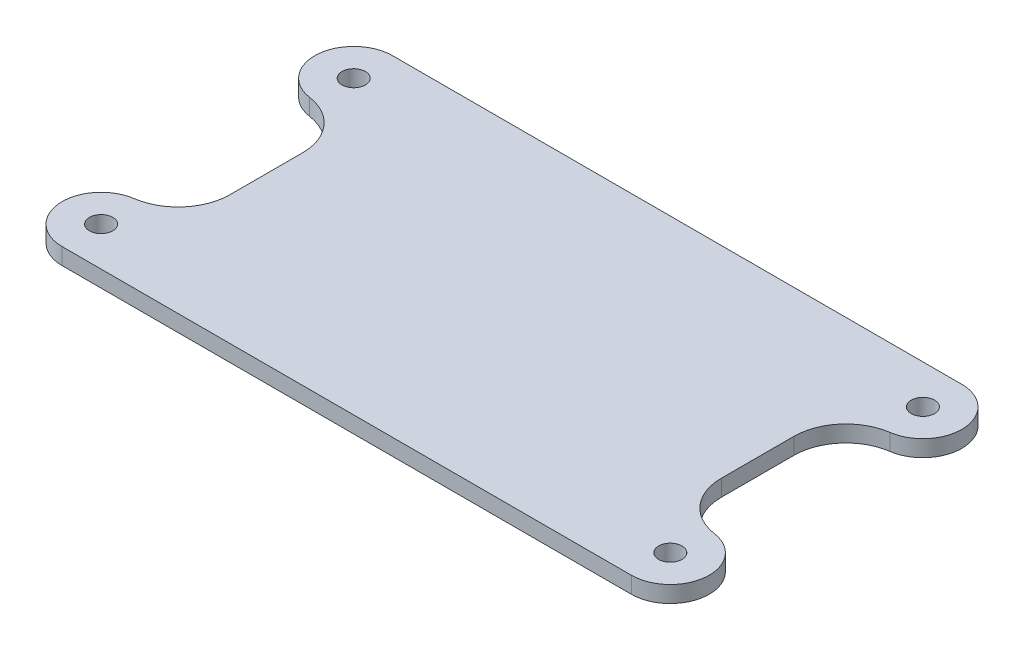
from build123d import *

# Parameters (mm, degrees)
SKETCH1_R           = 2.2479
BOSS_EXTRUDE1_DEPTH = 1.5875


with BuildPart() as part:
    # Sketch1 → Boss-Extrude1 (new, symmetric)
    with BuildSketch(Plane(origin=(0, 0, 0), x_dir=(1, 0, 0), z_dir=(0, 1, 0))):
        with BuildLine():
            Line((-47.25, 6.976491924), (-47.25, -6.976491924))
            ThreePointArc((-47.25, -6.976491924), (-49.69071054, -13.523028631), (-55.821428571, -16.87392511))
            ThreePointArc((-55.821428571, -16.87392511), (-60.419467095, -19.38709747), (-62.25, -24.297))
            ThreePointArc((-62.25, -24.297), (-60.053300859, -29.600300859), (-54.75, -31.797))
            Line((-54.75, -31.797), (54.75, -31.797))
            ThreePointArc((54.75, -31.797), (60.053300859, -29.600300859), (62.25, -24.297))
            ThreePointArc((62.25, -24.297), (60.419467095, -19.38709747), (55.821428571, -16.87392511))
            ThreePointArc((55.821428571, -16.87392511), (49.69071054, -13.523028631), (47.25, -6.976491924))
            Line((47.25, -6.976491924), (47.25, 6.976491924))
            ThreePointArc((47.25, 6.976491924), (49.69071054, 13.523028631), (55.821428571, 16.87392511))
            ThreePointArc((55.821428571, 16.87392511), (60.419467095, 19.38709747), (62.25, 24.297))
            ThreePointArc((62.25, 24.297), (60.053300859, 29.600300859), (54.75, 31.797))
            Line((54.75, 31.797), (-54.75, 31.797))
            ThreePointArc((-54.75, 31.797), (-60.053300859, 29.600300859), (-62.25, 24.297))
            ThreePointArc((-62.25, 24.297), (-60.419467095, 19.38709747), (-55.821428571, 16.87392511))
            ThreePointArc((-55.821428571, 16.87392511), (-49.69071054, 13.523028631), (-47.25, 6.976491924))
        make_face()
        with Locations((54.75, 24.297)):
            Circle(SKETCH1_R, mode=Mode.SUBTRACT)
        with Locations((54.75, -24.297)):
            Circle(SKETCH1_R, mode=Mode.SUBTRACT)
        with Locations((-54.75, -24.297)):
            Circle(SKETCH1_R, mode=Mode.SUBTRACT)
        with Locations((-54.75, 24.297)):
            Circle(SKETCH1_R, mode=Mode.SUBTRACT)
    extrude(amount=BOSS_EXTRUDE1_DEPTH, both=True)


solid = part.part
